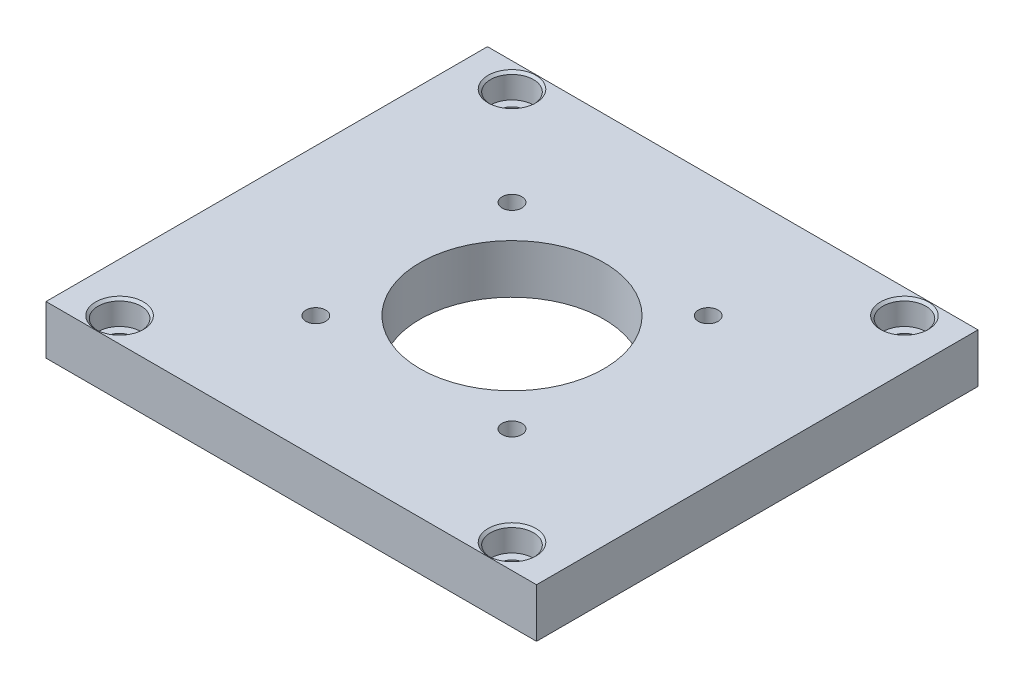
from build123d import *

# Parameters (mm, degrees)
SKETCH1_W                                     = 127
SKETCH1_H                                     = 114.3
BOSS_EXTRUDE1_DEPTH                           = 12.7
SKETCH2_R                                     = 23.8125
CUT_EXTRUDE1_DEPTH                            = 87.36933773
CBORE_FOR_1_4_SOCKET_HEAD_CAP_SCREW1_AT_COUNT = 2
CBORE_FOR_1_4_SOCKET_HEAD_CAP_SCREW1_AT_PITCH = 101.6
CBORE_FOR_1_4_SOCKET_HEAD_CAP_SCREW1_2_COUNT  = 2
CBORE_FOR_1_4_SOCKET_HEAD_CAP_SCREW1_2_PITCH  = 143.684097937
CBORE_FOR_1_4_SOCKET_HEAD_CAP_SCREW1_3_COUNT  = 2
CBORE_FOR_1_4_SOCKET_HEAD_CAP_SCREW1_3_PITCH  = 101.6
F_1_4_20_TAPPED_HOLE1_D                       = 5.1054
F_1_4_20_TAPPED_HOLE1_DEPTH                   = 16.51
F_1_4_20_TAPPED_HOLE1_TIP                     = 1.533816902


with BuildPart() as part:
    # Sketch1 → Boss-Extrude1 (new body)
    with BuildSketch(Plane(origin=(0, 0, 0), x_dir=(1, 0, 0), z_dir=(0, 1, 0))):
        Rectangle(SKETCH1_W, SKETCH1_H)
    extrude(amount=BOSS_EXTRUDE1_DEPTH)

    # Sketch2 → Cut-Extrude1 (cut, through all)
    with BuildSketch(Plane(origin=(0, 12.7, 0), x_dir=(1, 0, 0), z_dir=(0, 1, 0))):
        Circle(SKETCH2_R)
    extrude(amount=-CUT_EXTRUDE1_DEPTH, mode=Mode.SUBTRACT)

    # Sketch5 → CBORE for 1/4 Socket Head Cap Screw1 (revolve, cut)
    with BuildSketch(Plane(origin=(-50.8, 12.7, -50.8), x_dir=(0, 0, 1), z_dir=(1, 0, 0))):
        Polygon((0, 0), (0, 12.7), (3.3782, 12.7), (3.3782, 6.35), (5.55625, 6.35), (5.55625, 0.635), (6.19125, 0), align=None)
    cbore_for_1_4_socket_head_cap_screw1 = revolve(axis=Axis((-50.8, 19.05, -50.8), (0, -1, 0)), mode=Mode.SUBTRACT)

    # CBORE for 1/4 Socket Head Cap Screw1 at: CBORE for 1/4 Socket Head Cap Screw1 ×2
    with Locations(*[(i * CBORE_FOR_1_4_SOCKET_HEAD_CAP_SCREW1_AT_PITCH, 0, 0) for i in range(1, CBORE_FOR_1_4_SOCKET_HEAD_CAP_SCREW1_AT_COUNT)]):
        add(cbore_for_1_4_socket_head_cap_screw1, mode=Mode.SUBTRACT)

    # CBORE for 1_4 Socket Head Cap Screw1 2: CBORE for 1/4 Socket Head Cap Screw1 ×2
    with Locations(*[Vector(0.7071067811865476, 0, 0.7071067811865475) * (i * CBORE_FOR_1_4_SOCKET_HEAD_CAP_SCREW1_2_PITCH) for i in range(1, CBORE_FOR_1_4_SOCKET_HEAD_CAP_SCREW1_2_COUNT)]):
        add(cbore_for_1_4_socket_head_cap_screw1, mode=Mode.SUBTRACT)

    # CBORE for 1_4 Socket Head Cap Screw1 3: CBORE for 1/4 Socket Head Cap Screw1 ×2
    with Locations(*[(0, 0, i * CBORE_FOR_1_4_SOCKET_HEAD_CAP_SCREW1_3_PITCH) for i in range(1, CBORE_FOR_1_4_SOCKET_HEAD_CAP_SCREW1_3_COUNT)]):
        add(cbore_for_1_4_socket_head_cap_screw1, mode=Mode.SUBTRACT)

    # 1/4-20 Tapped Hole1
    with Locations(Plane(origin=(-25.4, 12.7, -25.4), x_dir=(0, 0, 1), z_dir=(0, 1, 0))):
        with Locations((0, 0), (0, 50.8), (50.8, 50.8), (50.8, 0)):
            Hole(F_1_4_20_TAPPED_HOLE1_D / 2, depth=F_1_4_20_TAPPED_HOLE1_DEPTH)
            with Locations((0, 0, -(F_1_4_20_TAPPED_HOLE1_DEPTH + F_1_4_20_TAPPED_HOLE1_TIP / 2))):  # 118° drill point
                Cone(0, F_1_4_20_TAPPED_HOLE1_D / 2, F_1_4_20_TAPPED_HOLE1_TIP, mode=Mode.SUBTRACT)


solid = part.part
